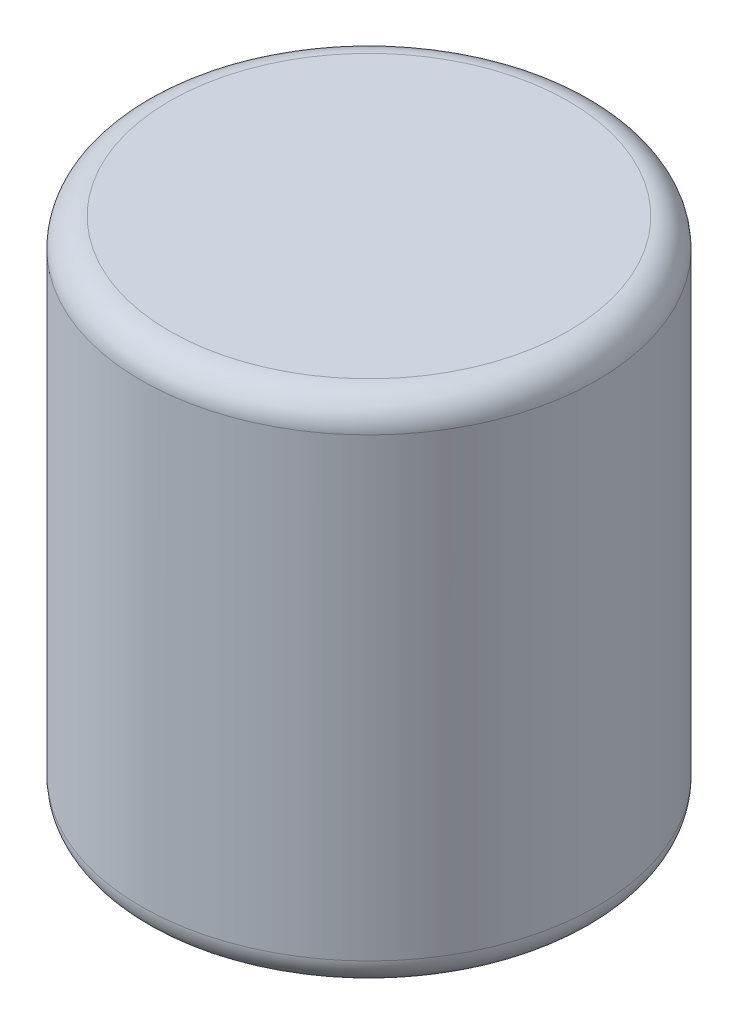
from build123d import *

# Parameters (mm, degrees)
FILLET1_R = 1


with BuildPart() as part:
    # Sketch1 → Revolve1 (revolve)
    with BuildSketch(Plane.XY):
        Polygon((6.2, 0), (8, 0), (8, 18), (0, 18), (0, 16.5), (5.5, 16.5), (5.5, 15.25), (6.2, 15.25), (6.2, 14.5), (6.5, 14.5), (6.5, 0.75), (6.2, 0.75), align=None)
    revolve(axis=Axis((0, 0, 0), (0, 1, 0)))

    # Fillet1
    fillet1_edges = [part.edges().sort_by_distance(p)[0] for p in [
        (-8, 0, 0),
        (-8, 18, 0),
    ]]
    fillet(fillet1_edges, radius=FILLET1_R)


solid = part.part
